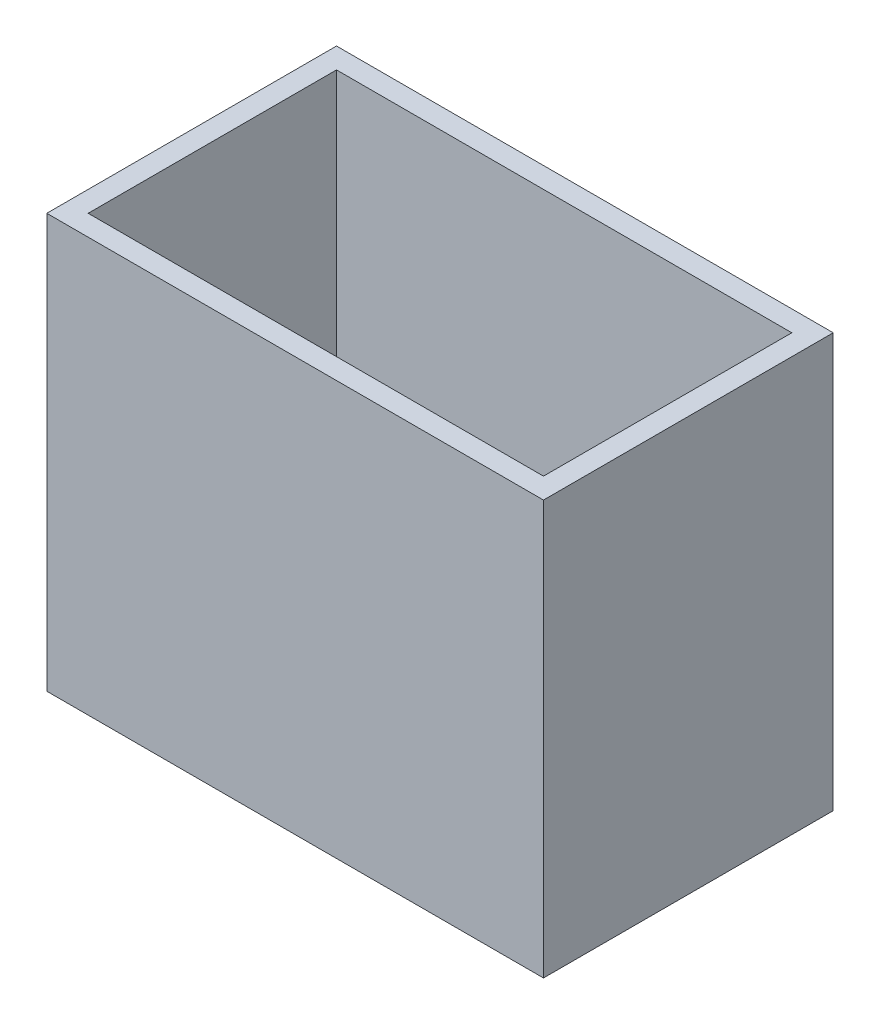
from build123d import *

# Parameters (mm, degrees)
SKETCH_1_W      = 120
SKETCH_1_H      = 70
EXTRUDE_1_DEPTH = 100
SHELL_1_T       = -5


with BuildPart() as part:
    # 草图1 → 凸台-拉伸1 (new body)
    with BuildSketch(Plane(origin=(0, 0, 0), x_dir=(1, 0, 0), z_dir=(0, 1, 0))):
        Rectangle(SKETCH_1_W, SKETCH_1_H)
    extrude(amount=EXTRUDE_1_DEPTH)

    # 抽壳1
    shell_1_openings = [part.faces().sort_by_distance(p)[0] for p in [
        (0, 100, 0),
    ]]
    offset(amount=SHELL_1_T, openings=shell_1_openings, kind=Kind.INTERSECTION)


solid = part.part
